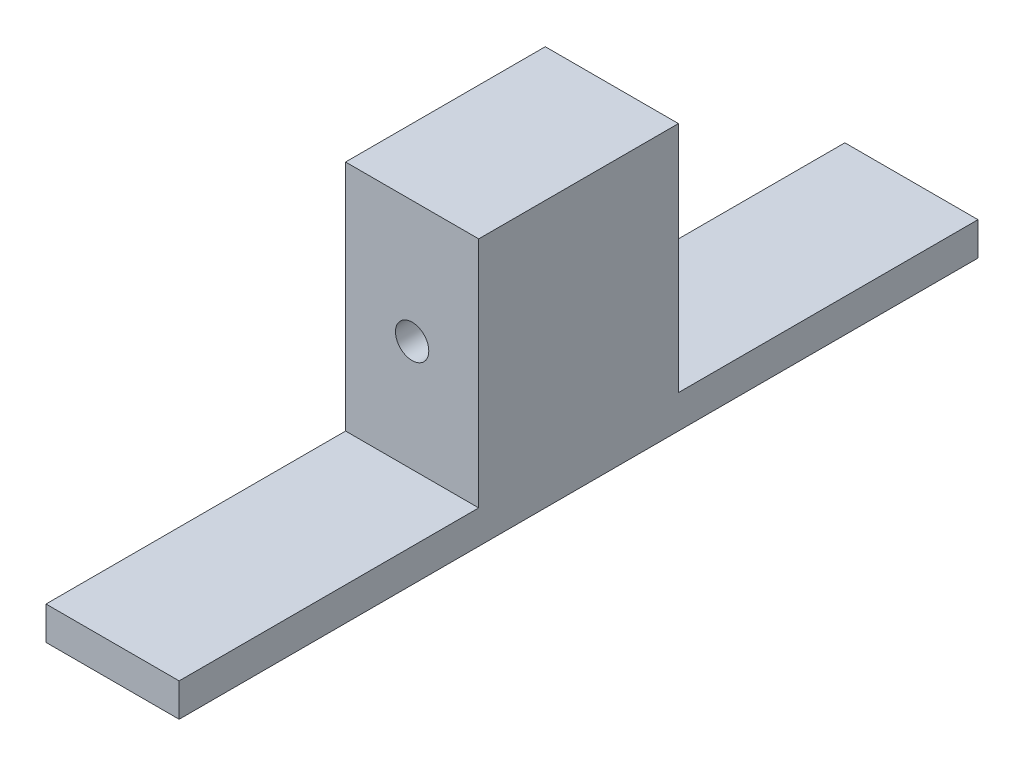
from build123d import *

# Parameters (mm, degrees)
BOSS_EXTRUDE1_DEPTH         = 25.4
F_1_4_0_25_DIAMETER_HOLE1_D = 6.35


with BuildPart() as part:
    # Sketch-Profile → Boss-Extrude1 (new body)
    with BuildSketch(Plane(origin=(0, 0, 0), x_dir=(0, 0, -1), z_dir=(1, 0, 0))):
        Polygon((-76.2, 6.35), (-76.2, 0), (76.2, 0), (76.2, 6.35), (19.05, 6.35), (19.05, 50.8), (-19.05, 50.8), (-19.05, 6.35), align=None)
    extrude(amount=BOSS_EXTRUDE1_DEPTH)

    # 1/4 (0.25) Diameter Hole1 (through all)
    with Locations(Plane.XY.offset(19.05)):
        with Locations((12.7, 27.5181)):
            Hole(F_1_4_0_25_DIAMETER_HOLE1_D / 2)


solid = part.part
